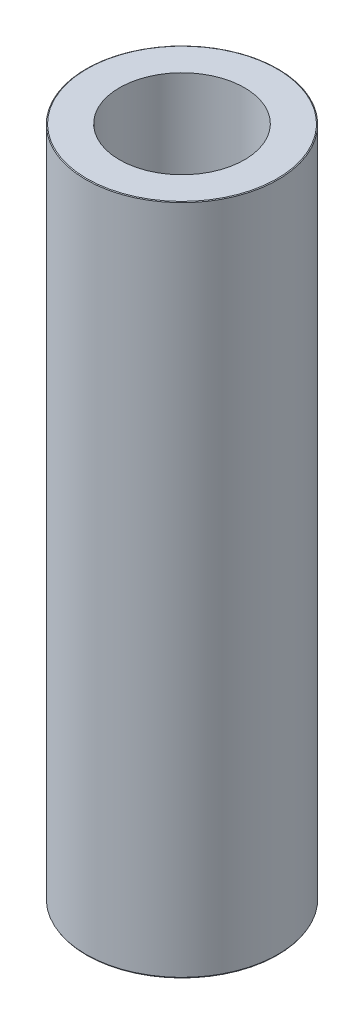
from build123d import *
from OCP.BRepFilletAPI import BRepFilletAPI_MakeChamfer

# Parameters (mm, degrees)
SKETCH1_R           = 60
BOSS_EXTRUDE1_DEPTH = 420.277864842
SKETCH2_R           = 39.071831554
CUT_EXTRUDE1_DEPTH  = 429.758071267
CHAMFER1_SIZE       = 0.312493304
CHAMFER1_SIZE2      = 0.54125428


with BuildPart() as part:
    # Sketch1 → Boss-Extrude1 (new body)
    with BuildSketch(Plane(origin=(0, 0, 0), x_dir=(1, 0, 0), z_dir=(0, 1, 0))):
        Circle(SKETCH1_R)
    extrude(amount=BOSS_EXTRUDE1_DEPTH)

    # Sketch2 → Cut-Extrude1 (cut, through all)
    with BuildSketch(Plane(origin=(0, 0, 0), x_dir=(1, 0, 0), z_dir=(0, 1, 0))):
        Circle(SKETCH2_R)
    extrude(amount=CUT_EXTRUDE1_DEPTH, mode=Mode.SUBTRACT)

    # Chamfer1: one chamfer whose edges measure the first distance from different faces: ONE call of the kernel's chamfer builder (chamfer() names one face for all edges)
    chamfer1_edges_1 = [part.edges().sort_by_distance(p)[0] for p in [
        (-60, 420.277864842, 0),
    ]]
    chamfer1_side_1 = [part.faces().sort_by_distance(p)[0] for p in [
        (-60, 210.138932421, 0),
    ]]
    chamfer1_edges_2 = [part.edges().sort_by_distance(p)[0] for p in [
        (-60, 0, 0),
    ]]
    chamfer1_side_2 = [part.faces().sort_by_distance(p)[0] for p in [
        (-58.302943725, 0, 0),
    ]]
    chamfer1 = BRepFilletAPI_MakeChamfer(part.part.solid().wrapped)
    for e in chamfer1_edges_1:
        chamfer1.Add(CHAMFER1_SIZE, CHAMFER1_SIZE2, e.wrapped, chamfer1_side_1[0].wrapped)  # the first distance lies on this face
    for e in chamfer1_edges_2:
        chamfer1.Add(CHAMFER1_SIZE, CHAMFER1_SIZE2, e.wrapped, chamfer1_side_2[0].wrapped)  # the first distance lies on this face
    add(Compound.cast(chamfer1.Shape()), mode=Mode.REPLACE)


solid = part.part
